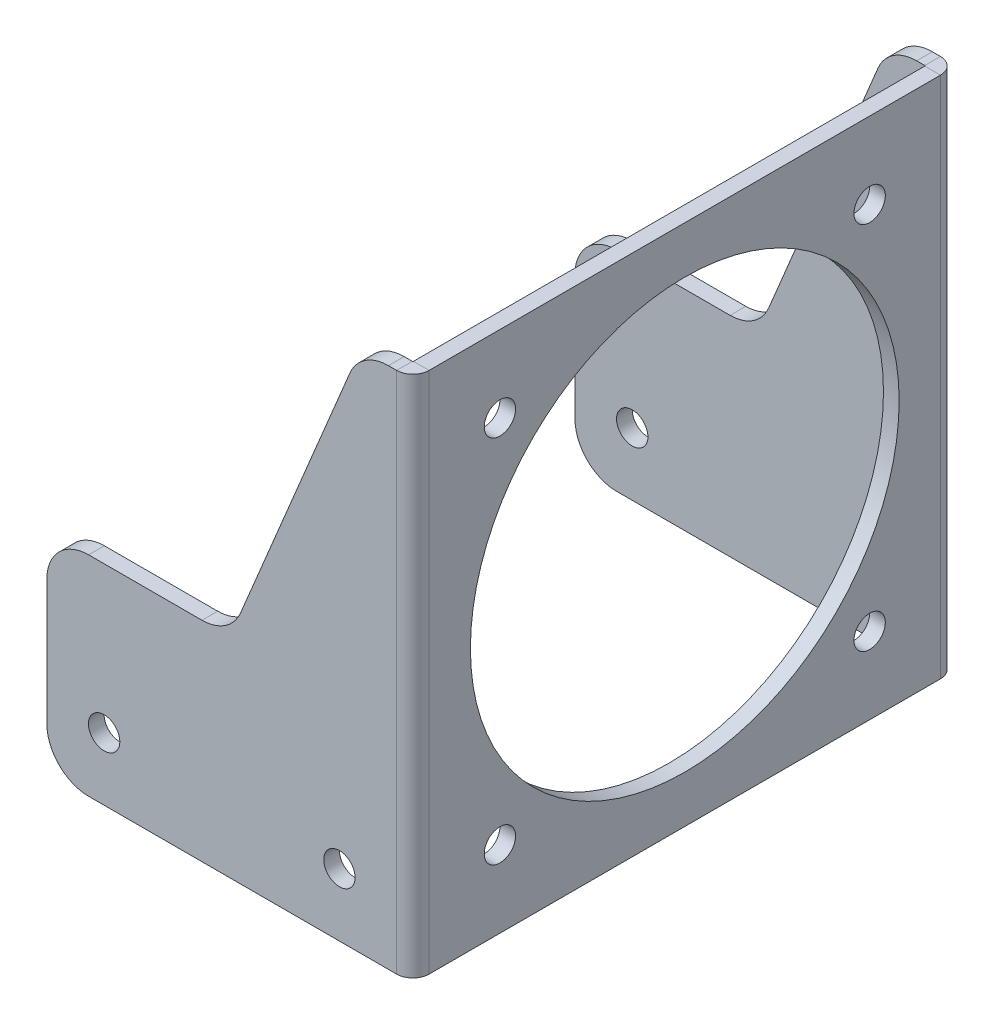
from build123d import *

# Parameters (mm, degrees)
SKETCH_1_W                         = 98
SKETCH_1_H                         = 100
SKETCH_1_R                         = 41
SKETCH_1_R_2                       = 3
SM_BASE_FLANGE_1_DEPTH             = 3
SM_EDGE_FLANGE_1_STRIP_W           = 12.2
SM_EDGE_FLANGE_1_STRIP_H           = 3
SM_EDGE_FLANGE_1_STRIP_CUT_DEPTH   = 100
SM_EDGE_FLANGE_1_STRIP_2_W         = 12.2
SM_EDGE_FLANGE_1_STRIP_2_H         = 3
SM_EDGE_FLANGE_1_STRIP_CUT_2_DEPTH = 100
SM_EDGE_FLANGE_1_DEPTH             = 100
SM_EDGE_FLANGE_1_BEND_DEPTH        = 100
SKETCH_8_R                         = 3
CUT_EXTRUDE_1_DEPTH                = 135.96666255
FILLET_1_R                         = 8


# Sheet-metal steps are written as plain solids
with BuildPart() as part:
    # Sketch 1 → 基体-法兰1 (new body)
    with BuildSketch(Plane(origin=(0, 0, 0), x_dir=(0, 0, -1), z_dir=(1, 0, 0))):
        Rectangle(SKETCH_1_W, SKETCH_1_H)
        Circle(SKETCH_1_R, mode=Mode.SUBTRACT)
        with Locations((-35.355339059, 35.355339059)):
            Circle(SKETCH_1_R_2, mode=Mode.SUBTRACT)
        with Locations((35.355339059, 35.355339059)):
            Circle(SKETCH_1_R_2, mode=Mode.SUBTRACT)
        with Locations((35.355339059, -35.355339059)):
            Circle(SKETCH_1_R_2, mode=Mode.SUBTRACT)
        with Locations((-35.355339059, -35.355339059)):
            Circle(SKETCH_1_R_2, mode=Mode.SUBTRACT)
    extrude(amount=-SM_BASE_FLANGE_1_DEPTH)

    # 边线-法兰1 strip (across the edge) → 边线-法兰1 strip cut (cut)
    with BuildSketch(Plane(origin=(-3, -50, 49), x_dir=(0, 0, -1), z_dir=(0, 1, 0))):
        with Locations((-6, -1.5)):
            Rectangle(SM_EDGE_FLANGE_1_STRIP_W, SM_EDGE_FLANGE_1_STRIP_H)
    extrude(amount=SM_EDGE_FLANGE_1_STRIP_CUT_DEPTH, mode=Mode.SUBTRACT)

    # 边线-法兰1 strip 2 (across the edge) → 边线-法兰1 strip cut 2 (cut)
    with BuildSketch(Plane(origin=(-3, 50, -49), x_dir=(0, 0, 1), z_dir=(0, -1, 0))):
        with Locations((-6, -1.5)):
            Rectangle(SM_EDGE_FLANGE_1_STRIP_2_W, SM_EDGE_FLANGE_1_STRIP_2_H)
    extrude(amount=SM_EDGE_FLANGE_1_STRIP_CUT_2_DEPTH, mode=Mode.SUBTRACT)

    # 边线-法兰1 section (across the edge) → 边线-法兰1 (add)
    with BuildSketch(Plane(origin=(-3, -50, 49), x_dir=(0, 0, -1), z_dir=(0, 1, 0))):
        with BuildLine():
            Line((-3, 0.1), (-3, 67))
            Line((-3, 67), (0, 67))
            Line((0, 67), (0, 0.1))
            ThreePointArc((0, 0.1), (0.029289322, 0.029289322), (0.1, 0))
            Line((0.1, 0), (0.1, -3))
            ThreePointArc((0.1, -3), (-2.092031022, -2.092031022), (-3, 0.1))
        make_face()
    extrude(amount=SM_EDGE_FLANGE_1_DEPTH)

    # 边线-法兰1 section 2 (across the edge) → 边线-法兰1 bend (add)
    with BuildSketch(Plane(origin=(-3, 50, -49), x_dir=(0, 0, 1), z_dir=(0, -1, 0))):
        with BuildLine():
            Line((-3, 0.1), (-3, 67))
            Line((-3, 67), (0, 67))
            Line((0, 67), (0, 0.1))
            ThreePointArc((0, 0.1), (0.029289322, 0.029289322), (0.1, 0))
            Line((0.1, 0), (0.1, -3))
            ThreePointArc((0.1, -3), (-2.092031022, -2.092031022), (-3, 0.1))
        make_face()
    extrude(amount=SM_EDGE_FLANGE_1_BEND_DEPTH)

    # 草图8 → 切除-拉伸1 (cut, through all)
    with BuildSketch(Plane.XY.offset(52)):
        with Locations((-14.05, -38)):
            Circle(SKETCH_8_R)
        with Locations((-59.05, -38)):
            Circle(SKETCH_8_R)
        Polygon((-10, 50), (-70, 50), (-70, -10), (-35, -10), align=None)
    extrude(amount=-CUT_EXTRUDE_1_DEPTH, mode=Mode.SUBTRACT)

    # 圆角1
    fillet_1_edges = [part.edges().sort_by_distance(p)[0] for p in [
        (-10, 50, 50.5),
        (-70, -10, 50.5),
        (-35, -10, 50.5),
        (-10, 50, -50.5),
        (-35, -10, -50.5),
        (-70, -10, -50.5),
        (-70, -50, 50.5),
        (-70, -50, -50.5),
    ]]
    fillet(fillet_1_edges, radius=FILLET_1_R)


solid = part.part
